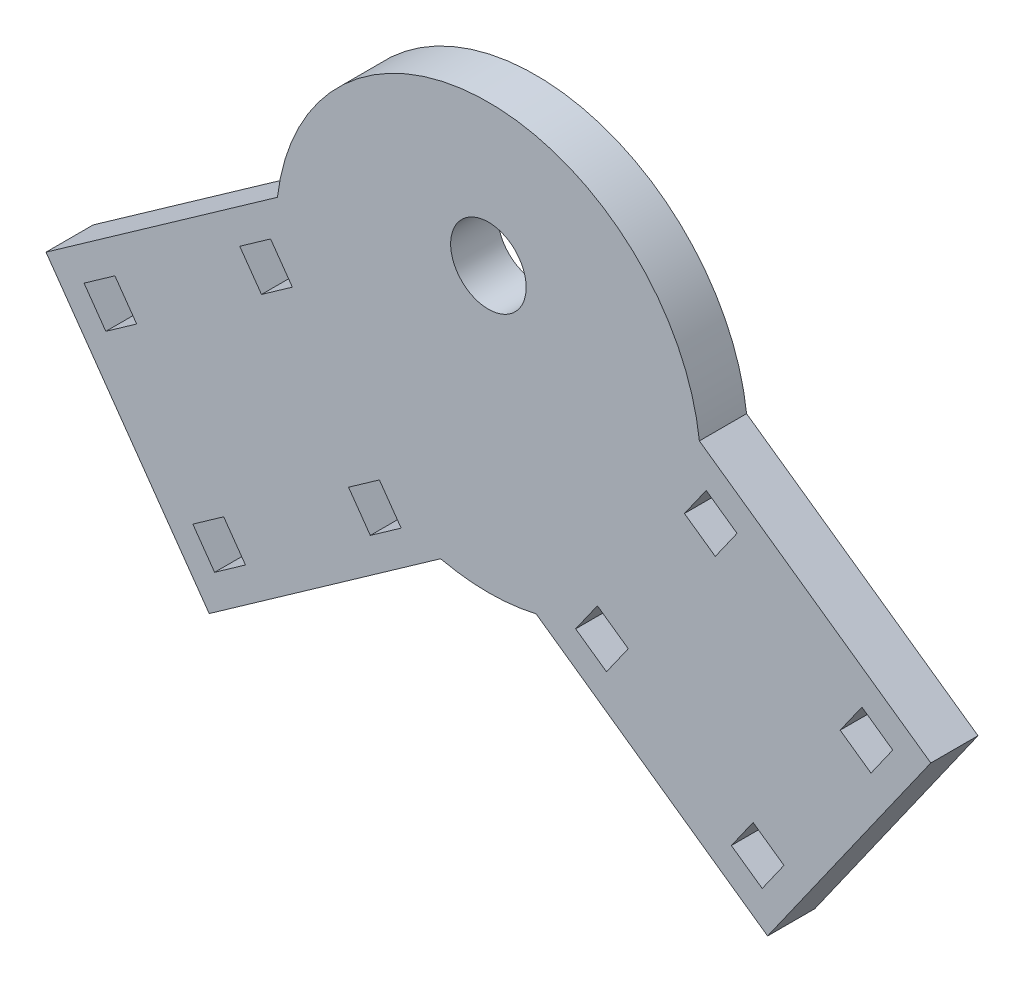
from build123d import *

# Parameters (mm, degrees)
SKETCH2_R           = 22.5
SKETCH2_R_2         = 4
BOSS_EXTRUDE1_DEPTH = 5
CUT_EXTRUDE1_DEPTH  = 10


with BuildPart() as part:
    # Sketch2 → Boss-Extrude1 (new body)
    # profile 1 of 3: a face of its own
    with BuildSketch(Plane.XY):
        Circle(SKETCH2_R)
        with Locations((0, 7.5)):
            Circle(SKETCH2_R_2, mode=Mode.SUBTRACT)
    # profile 2 of 3: a face of its own
    with BuildSketch(Plane.XY):
        Polygon((5.061398723, -21.923326458), (22.349954637, 2.594133329), (46.867414424, -14.694422585), (29.57885851, -39.211882372), align=None)
    # profile 3 of 3: a face of its own
    with BuildSketch(Plane.XY):
        Polygon((-5.061398723, -21.923326458), (-22.349954637, 2.594133329), (-46.867414424, -14.694422585), (-29.57885851, -39.211882372), align=None)
    extrude(amount=BOSS_EXTRUDE1_DEPTH)

    # Sketch4 → Cut-Extrude1 (cut)
    with BuildSketch(Plane.XY.offset(5)):
        Polygon((-42.837051435, -15.523254131), (-39.568056796, -13.218113343), (-37.262916008, -16.487107981), (-40.531910646, -18.792248769), align=None)
        Polygon((-31.311347492, -31.868227322), (-28.042352854, -29.563086534), (-25.737212065, -32.832081172), (-29.006206703, -35.137221961), align=None)
        Polygon((-11.547141081, -17.931441432), (-14.81613572, -20.236582221), (-12.510994931, -23.505576859), (-9.242000293, -21.20043607), align=None)
        Polygon((-26.341839662, -3.891609029), (-23.072845024, -1.586468241), (-20.767704236, -4.855462879), (-24.036698874, -7.160603668), align=None)
        Polygon((23.072845024, -1.586468241), (26.341839662, -3.891609029), (24.036698874, -7.160603668), (20.767704236, -4.855462879), align=None)
        Polygon((37.262916008, -16.487107981), (39.568056796, -13.218113343), (42.837051435, -15.523254131), (40.531910646, -18.792248769), align=None)
        Polygon((28.042352854, -29.563086534), (31.311347492, -31.868227322), (29.006206703, -35.137221961), (25.737212065, -32.832081172), align=None)
        Polygon((11.547141081, -17.931441432), (14.81613572, -20.236582221), (12.510994931, -23.505576859), (9.242000293, -21.20043607), align=None)
    extrude(amount=-CUT_EXTRUDE1_DEPTH, mode=Mode.SUBTRACT)


solid = part.part
